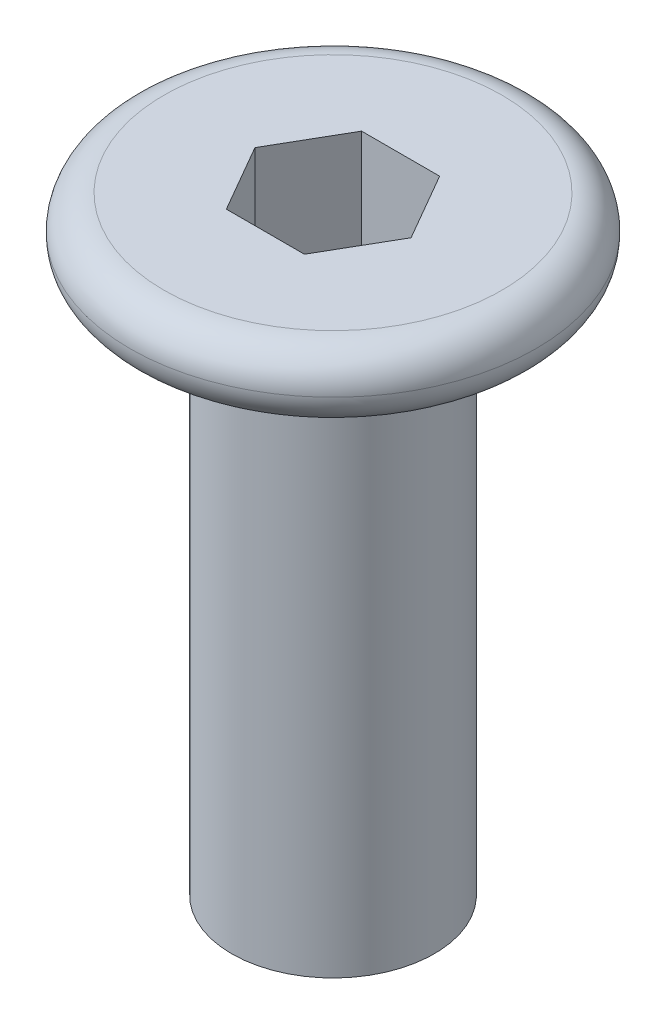
from build123d import *

# Parameters (mm, degrees)
SKETCH_1_R          = 3
EXTRUDE_1_DEPTH     = 1
SKETCH_2_R          = 1.5
EXTRUDE_2_DEPTH     = 8
CUT_EXTRUDE_1_DEPTH = 2
FILLET_1_R          = 0.5


with BuildPart() as part:
    # 草图1 → 凸台-拉伸1 (new body)
    with BuildSketch(Plane(origin=(0, 0, 0), x_dir=(1, 0, 0), z_dir=(0, 1, 0))):
        with Locations(Location((0, 0, 0), (0, 0, 270))):
            Circle(SKETCH_1_R)
    extrude(amount=EXTRUDE_1_DEPTH)

    # 草图2 → 凸台-拉伸2 (add)
    with BuildSketch(Plane.XZ):
        with Locations(Location((0, 0, 0), (0, 0, 270))):
            Circle(SKETCH_2_R)
    extrude(amount=EXTRUDE_2_DEPTH)

    # 草图3 → 切除-拉伸1 (cut)
    with BuildSketch(Plane(origin=(0, 1, 0), x_dir=(1, 0, 0), z_dir=(0, 1, 0))):
        Polygon((0.577350269, -1), (1.154700538, 0), (0.577350269, 1), (-0.577350269, 1), (-1.154700538, 0), (-0.577350269, -1), align=None)
    extrude(amount=-CUT_EXTRUDE_1_DEPTH, mode=Mode.SUBTRACT)

    # 圆角1
    fillet_1_edges = [part.edges().sort_by_distance(p)[0] for p in [
        (0, 0, -3),
        (0, 1, -3),
    ]]
    fillet(fillet_1_edges, radius=FILLET_1_R - 0.0001)  # a hair under: the kernel refuses the full size


solid = part.part
